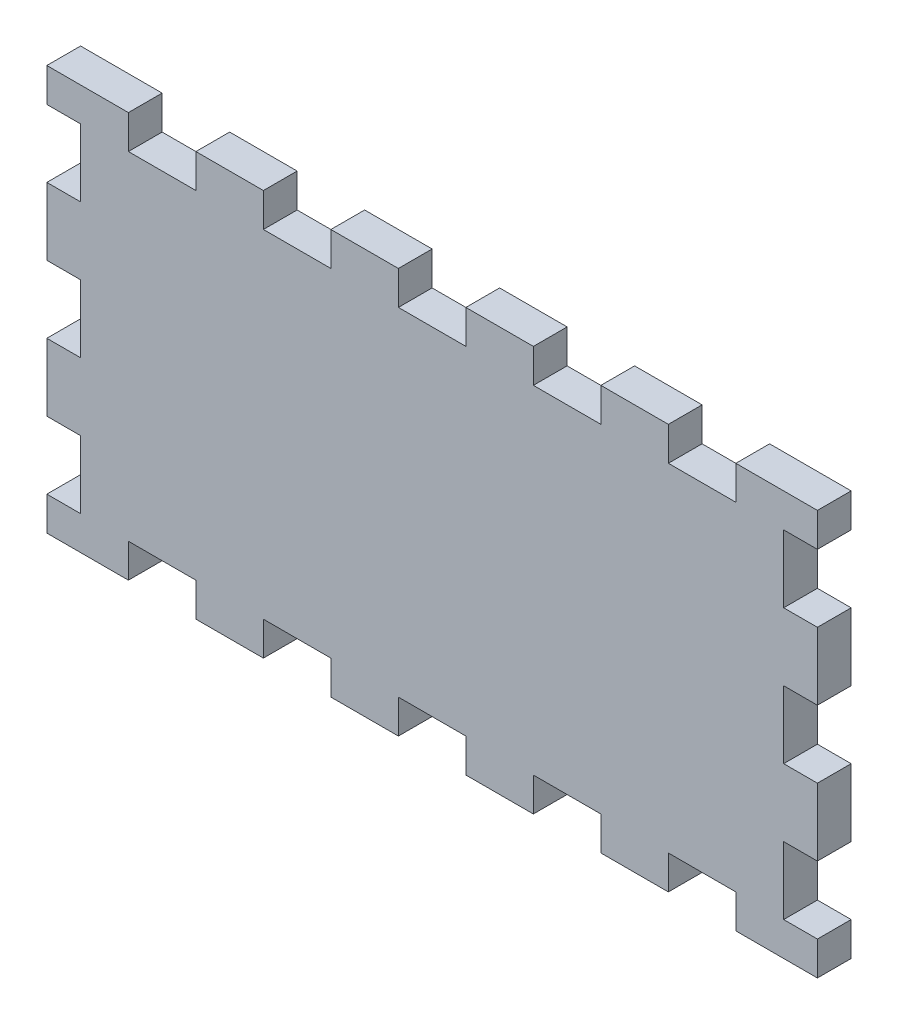
from build123d import *

# Parameters (mm, degrees)
BOSS_EXTRUDE1_DEPTH = 6
SKETCH3_W           = 6
SKETCH3_H           = 12
CUT_EXTRUDE1_DEPTH  = 6


with BuildPart() as part:
    # Sketch2 → Boss-Extrude1 (new body)
    with BuildSketch(Plane.XY):
        Polygon((-68.5, 0), (-54, 0), (-54, 6), (-42, 6), (-42, 0), (-30, 0), (-30, 6), (-18, 6), (-18, 0), (-6, 0), (-6, 6), (6, 6), (6, 0), (18, 0), (18, 6), (30, 6), (30, 0), (42, 0), (42, 6), (54, 6), (54, 0), (68.5, 0), (68.5, 72), (54, 72), (54, 66), (42, 66), (42, 72), (30, 72), (30, 66), (18, 66), (18, 72), (6, 72), (6, 66), (-6, 66), (-6, 72), (-18, 72), (-18, 66), (-30, 66), (-30, 72), (-42, 72), (-42, 66), (-54, 66), (-54, 72), (-68.5, 72), align=None)
    extrude(amount=BOSS_EXTRUDE1_DEPTH)

    # Sketch3 → Cut-Extrude1 (cut)
    with BuildSketch(Plane.XY.offset(6)):
        with Locations((-65.5, 12)):
            Rectangle(SKETCH3_W, SKETCH3_H)
        with Locations((-65.5, 60)):
            Rectangle(SKETCH3_W, SKETCH3_H)
        with Locations((-65.5, 36)):
            Rectangle(SKETCH3_W, SKETCH3_H)
        with Locations((65.5, 60)):
            Rectangle(SKETCH3_W, SKETCH3_H)
        with Locations((65.5, 36)):
            Rectangle(SKETCH3_W, SKETCH3_H)
        with Locations((65.5, 12)):
            Rectangle(SKETCH3_W, SKETCH3_H)
    extrude(amount=-CUT_EXTRUDE1_DEPTH, mode=Mode.SUBTRACT)


solid = part.part
